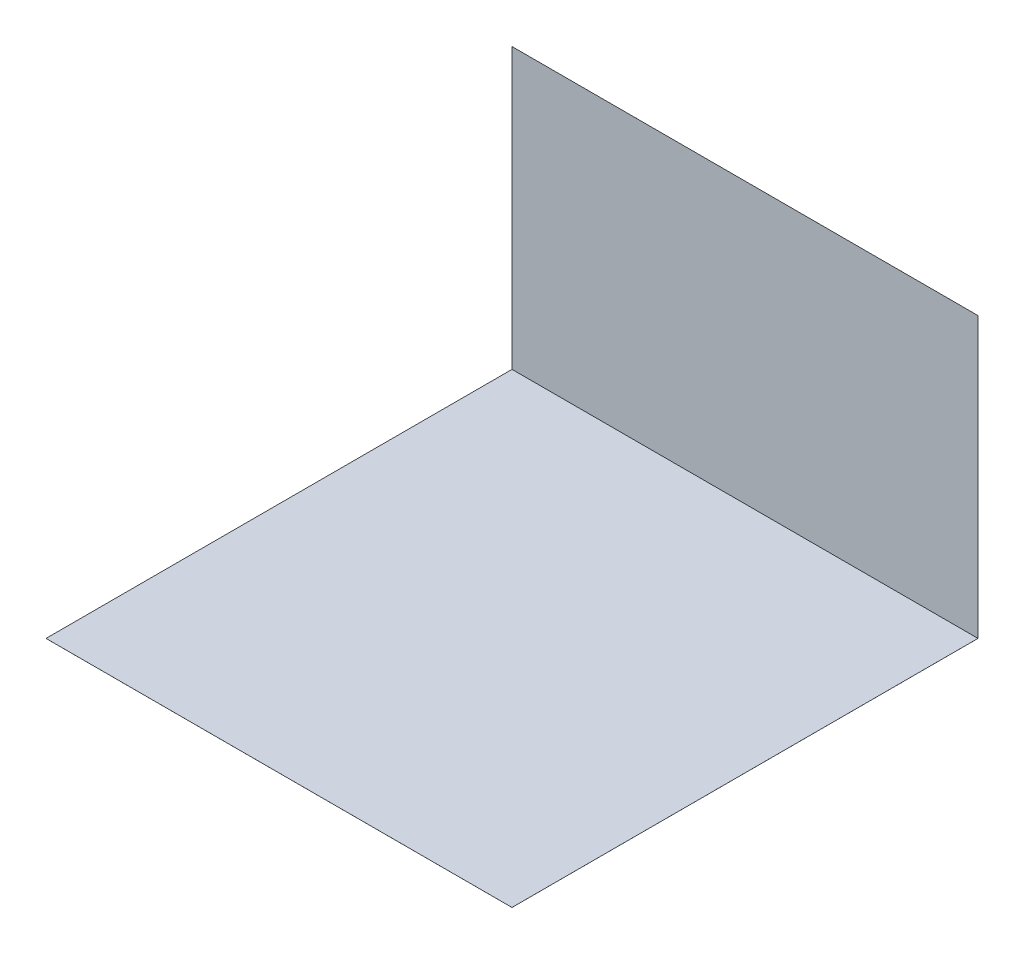
from build123d import *

# Parameters (mm, degrees)
SKETCH2_W     = 5000
SKETCH2_H     = 5000
FLOOR_2_DEPTH = 0.254
SKETCH4_W     = 5000
SKETCH4_H     = 0.0254
WALL1_DEPTH   = 3000


with BuildPart() as part:
    # Sketch2 → Floor 2 (new body)
    with BuildSketch(Plane(origin=(0, 0, 0), x_dir=(1, 0, 0), z_dir=(0, 1, 0))):
        with Locations((2416.97962963, -2479.656481481)):
            Rectangle(SKETCH2_W, SKETCH2_H)
    extrude(amount=FLOOR_2_DEPTH)


with BuildPart() as body_2:
    # Sketch4 → Wall1 (new body)
    with BuildSketch(Plane(origin=(0, 0.254, 0), x_dir=(1, 0, 0), z_dir=(0, 1, 0))):
        with Locations((2416.97962963, 20.356218519)):
            Rectangle(SKETCH4_W, SKETCH4_H)
    extrude(amount=WALL1_DEPTH)


solid = Compound([part.part, body_2.part])
